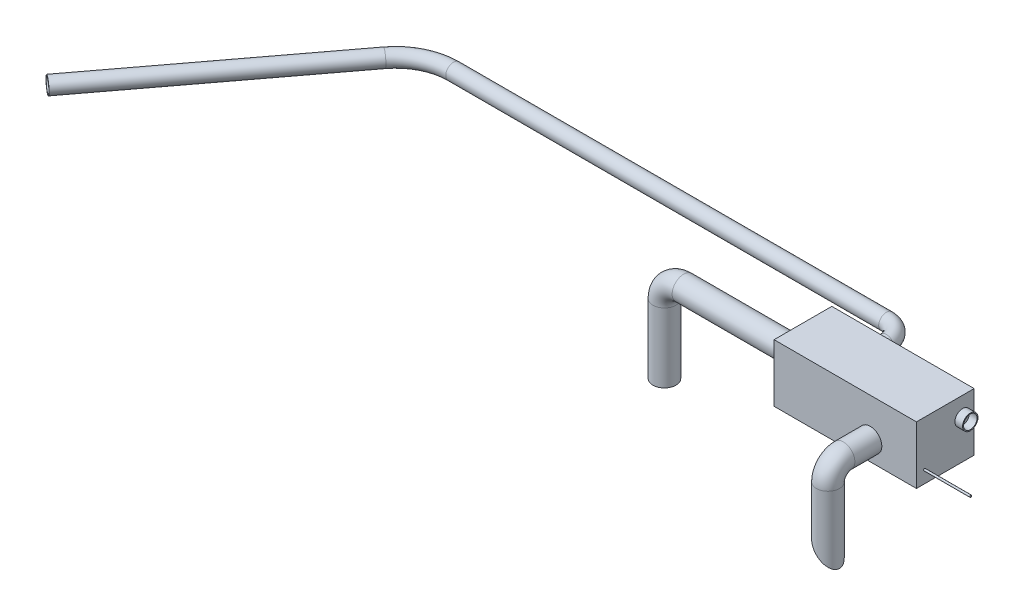
from build123d import *

# Parameters (mm, degrees)
SKETCH1_W           = 939.8
SKETCH1_H           = 381
BOSS_EXTRUDE1_DEPTH = 381
SKETCH2_R           = 76.2
SKETCH2_R_2         = 69.85
BOSS_EXTRUDE2_DEPTH = 152.4
SKETCH3_R           = 50.8
SKETCH3_R_2         = 44.45
BOSS_EXTRUDE3_DEPTH = 50.8
SKETCH4_R           = 6.35
BOSS_EXTRUDE4_DEPTH = 304.8
SKETCH5_R           = 50.8
SKETCH5_R_2         = 44.45
BOSS_EXTRUDE5_DEPTH = 50.8
SKETCH6_R           = 76.2
SKETCH6_R_2         = 69.85
BOSS_EXTRUDE6_DEPTH = 762
SKETCH7_R           = 76.2
SKETCH7_R_2         = 69.85
CUT_EXTRUDE3_DEPTH  = 1375.947304445
SKETCH27_R          = 76.2
SKETCH27_R_2        = 69.85
SKETCH29_R          = 50.8
SKETCH29_R_2        = 44.45


with BuildPart() as part:
    # Sketch1 → Boss-Extrude1 (new body)
    with BuildSketch(Plane(origin=(0, 0, 0), x_dir=(1, 0, 0), z_dir=(0, 1, 0))):
        Rectangle(SKETCH1_W, SKETCH1_H)
    extrude(amount=BOSS_EXTRUDE1_DEPTH)

    # Sketch2 → Boss-Extrude2 (add)
    with BuildSketch(Plane.XY.offset(190.5)):
        with Locations((165.1, 127)):
            Circle(SKETCH2_R)
        with Locations((165.1, 127)):
            Circle(SKETCH2_R_2, mode=Mode.SUBTRACT)
    extrude(amount=BOSS_EXTRUDE2_DEPTH)

    # Sketch3 → Boss-Extrude3 (add)
    with BuildSketch(Plane(origin=(469.9, 0, 0), x_dir=(0, 0, -1), z_dir=(1, 0, 0))):
        with Locations((114.3, 254)):
            Circle(SKETCH3_R)
        with Locations((114.3, 254)):
            Circle(SKETCH3_R_2, mode=Mode.SUBTRACT)
    extrude(amount=BOSS_EXTRUDE3_DEPTH)

    # Sketch4 → Boss-Extrude4 (add)
    with BuildSketch(Plane(origin=(469.9, 0, 0), x_dir=(0, 0, -1), z_dir=(1, 0, 0))):
        with Locations((-136.850125002, 81.35113945)):
            Circle(SKETCH4_R)
    extrude(amount=BOSS_EXTRUDE4_DEPTH)

    # Sketch5 → Boss-Extrude5 (add)
    with BuildSketch(Plane(origin=(0, 0, -190.5), x_dir=(-1, 0, 0), z_dir=(0, 0, -1))):
        with Locations((185.69264526, 273.888159849)):
            Circle(SKETCH5_R)
        with Locations((185.69264526, 273.888159849)):
            Circle(SKETCH5_R_2, mode=Mode.SUBTRACT)
    extrude(amount=BOSS_EXTRUDE5_DEPTH)

    # Sketch6 → Boss-Extrude6 (add)
    with BuildSketch(Plane.ZY.offset(469.9)):
        with Locations((0, 190.5)):
            Circle(SKETCH6_R)
        with Locations((0, 190.5)):
            Circle(SKETCH6_R_2, mode=Mode.SUBTRACT)
    extrude(amount=BOSS_EXTRUDE6_DEPTH)

    # Sweep1: sweep along a path in Sketch8
    with BuildLine(Plane(origin=(165.1, 0, 0), x_dir=(0, 0, -1), z_dir=(1, 0, 0))) as sweep1_path:
        Line((-342.9, 127), (-368.3, 127))
        ThreePointArc((-368.3, 127), (-440.142048969, 97.242048969), (-469.9, 25.4))
        Line((-469.9, 25.4), (-469.9, -431.8))
    # Sketch7 → Sweep1 (sweep)
    with BuildSketch(Plane.XY.offset(342.9)):
        with Locations((165.1, 127)):
            Circle(SKETCH7_R)
        with Locations((165.1, 127)):
            Circle(SKETCH7_R_2, mode=Mode.SUBTRACT)
    sweep(path=sweep1_path.line)

    # Sketch22 → Cut-Extrude3 (cut, through all)
    with BuildSketch(Plane.XY.offset(190.5)):
        Polygon((88.9, -279.4), (241.3, -431.8), (88.9, -431.8), align=None)
    extrude(amount=CUT_EXTRUDE3_DEPTH, mode=Mode.SUBTRACT)

    # Sweep8: sweep along a path in Sketch26
    with BuildLine(Plane.XY) as sweep8_path:
        Line((-1231.9, 190.5), (-1257.3, 190.5))
        ThreePointArc((-1257.3, 190.5), (-1347.102561211, 153.302561211), (-1384.3, 63.5))
        Line((-1384.3, 63.5), (-1384.3, -393.7))
    # Sketch27 → Sweep8 (sweep)
    with BuildSketch(Plane.ZY.offset(1231.9)):
        with Locations((0, 190.5)):
            Circle(SKETCH27_R)
        with Locations((0, 190.5)):
            Circle(SKETCH27_R_2, mode=Mode.SUBTRACT)
    sweep(path=sweep8_path.line)

    # Sweep9: sweep along a path in Sketch28
    with BuildLine(Plane(origin=(0, 273.888159849, 0), x_dir=(1, 0, 0), z_dir=(0, 1, 0))) as sweep9_path:
        Line((-185.69264526, 241.3), (-185.69264526, 266.7))
        ThreePointArc((-185.69264526, 266.7), (-222.890084049, 356.502561211), (-312.69264526, 393.7))
        Line((-312.69264526, 393.7), (-3170.733052592, 393.7))
        ThreePointArc((-3170.733052592, 393.7), (-3340.734419386, 353.66999177), (-3475.01318192, 241.991523821))
        Line((-3475.01318192, 241.991523821), (-4430.719756424, -1026.273936864))
    # Sketch29 → Sweep9 (sweep)
    with BuildSketch(Plane(origin=(0, 0, -241.3), x_dir=(-1, 0, 0), z_dir=(0, 0, -1))):
        with Locations((185.69264526, 273.888159849)):
            Circle(SKETCH29_R)
        with Locations((185.69264526, 273.888159849)):
            Circle(SKETCH29_R_2, mode=Mode.SUBTRACT)
    sweep(path=sweep9_path.line)


solid = part.part
